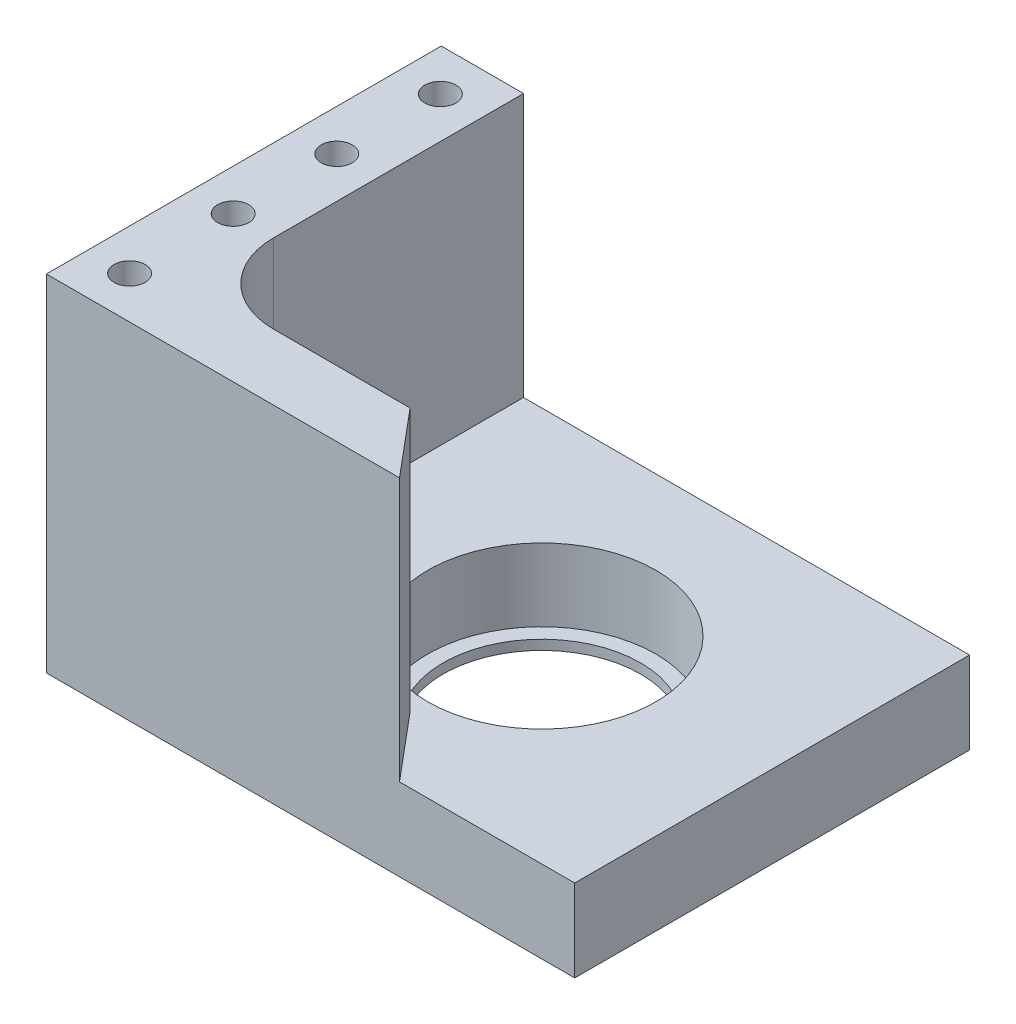
from build123d import *

# Parameters (mm, degrees)
SKETCH1_W            = 50.975
SKETCH1_H            = 38.1
BASE_DEPTH           = 7.9375
SKETCH2_R            = 11
BEARING_BORE_DEPTH   = 7
THRU_HOLE_DEPTH      = 36.191831439
THRU_HOLE_DEPTH_BACK = 36.191831439
SKETCH3_R            = 9.525
SKETCH4_W            = 7.9375
SKETCH4_H            = 38.1
VERTICAL_DEPTH       = 25.4
SKETCH7_W            = 6.35
SKETCH7_H            = 25.4
ARM_STOP_DEPTH       = 20.8026
ANGLED_FACE_REACH    = 49.967
FILLET1_R            = 7.62
SKETCH6_R            = 1.5
DOWEL_HOLES_DEPTH    = 7.007999954


with BuildPart() as part:
    # Sketch1 → Base (new body)
    with BuildSketch(Plane(origin=(0, 0, 0), x_dir=(1, 0, 0), z_dir=(0, 1, 0))):
        with Locations((-3.2625, 0)):
            Rectangle(SKETCH1_W, SKETCH1_H)
    extrude(amount=BASE_DEPTH)

    # Sketch2 → Bearing Bore (cut)
    with BuildSketch(Plane(origin=(0, 7.9375, 0), x_dir=(1, 0, 0), z_dir=(0, 1, 0))):
        Circle(SKETCH2_R)
    extrude(amount=-BEARING_BORE_DEPTH, mode=Mode.SUBTRACT)

    # Sketch3 → Thru Hole (cut, two sides: drawn at the far end of the back side and taken through both)
    with BuildSketch(Plane(origin=(0, 0.9375, 0), x_dir=(1, 0, 0), z_dir=(0, 1, 0)).offset(-THRU_HOLE_DEPTH_BACK)):
        Circle(SKETCH3_R)
    extrude(amount=THRU_HOLE_DEPTH + THRU_HOLE_DEPTH_BACK, mode=Mode.SUBTRACT)

    # Sketch4 → Vertical (add)
    with BuildSketch(Plane(origin=(0, 7.9375, 0), x_dir=(1, 0, 0), z_dir=(0, 1, 0))):
        with Locations((-24.78125, 0)):
            Rectangle(SKETCH4_W, SKETCH4_H)
    extrude(amount=VERTICAL_DEPTH)

    # Sketch7 → Arm Stop (add)
    with BuildSketch(Plane(origin=(-20.8125, 0, 0), x_dir=(0, 0, -1), z_dir=(1, 0, 0))):
        with Locations((-15.875, 20.6375)):
            Rectangle(SKETCH7_W, SKETCH7_H)
    extrude(amount=ARM_STOP_DEPTH)

    # Sketch8 → Angled Face (add, up to next)
    with BuildSketch(Plane(origin=(0, 33.3375, 0), x_dir=(1, 0, 0), z_dir=(0, 1, 0)), mode=Mode.PRIVATE) as angled_face_sk1:
        Polygon((-0.0099, -12.7), (5.318382658, -19.05), (-0.0099, -19.05), align=None)
    angled_face_tool1 = extrude(angled_face_sk1.sketch, amount=-ANGLED_FACE_REACH, mode=Mode.PRIVATE) - part.part
    add(angled_face_tool1.solids().sort_by_distance((1.766194, 33.3375, 16.933333))[0])

    # Fillet1
    fillet1_edges = [part.edges().sort_by_distance(p)[0] for p in [
        (-20.8125, 20.6375, 12.7),
    ]]
    fillet(fillet1_edges, radius=FILLET1_R)

    # Sketch6 → Dowel Holes (cut)
    with BuildSketch(Plane(origin=(0, 33.3375, 0), x_dir=(1, 0, 0), z_dir=(0, 1, 0))):
        with Locations((-24.78125, 14.990388599)):
            Circle(SKETCH6_R)
        with Locations((-24.78125, 4.9967962)):
            Circle(SKETCH6_R)
        with Locations((-24.78125, -14.990388599)):
            Circle(SKETCH6_R)
        with Locations((-24.78125, -4.9967962)):
            Circle(SKETCH6_R)
    extrude(amount=-DOWEL_HOLES_DEPTH, mode=Mode.SUBTRACT)


solid = part.part
